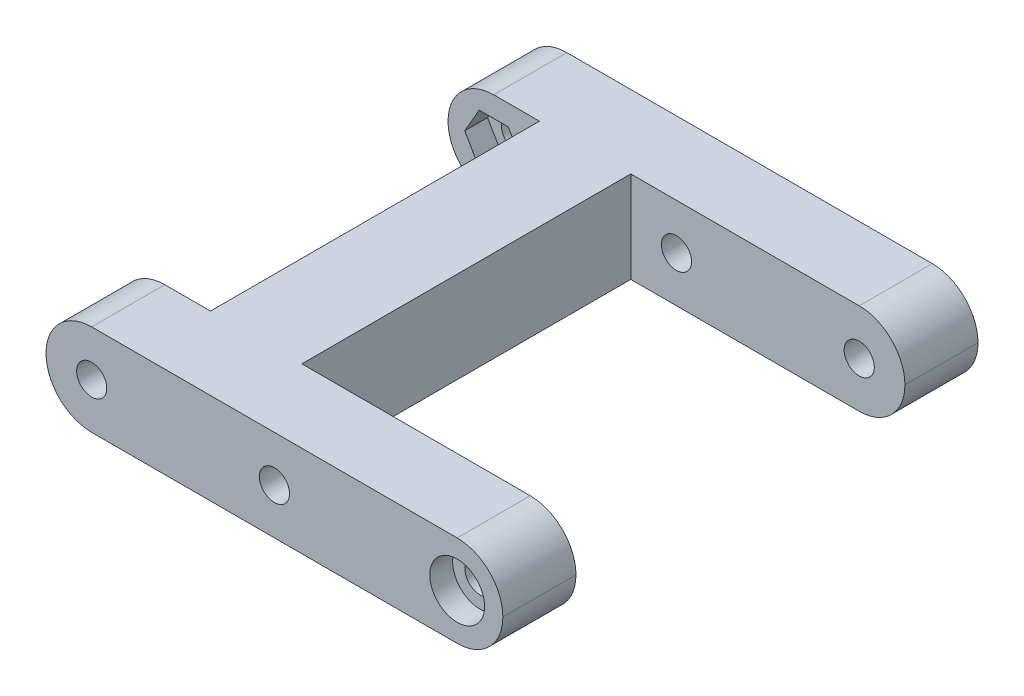
from build123d import *

# Parameters (mm, degrees)
SKICA1_W                 = 50
SKICA1_H                 = 10
P_IDAT_VYSUNUT_M1_DEPTH  = 8
SKICA2_R                 = 1.65
ODEBRAT_VYSUNUT_M1_DEPTH = 52.613951602
ZAOBLIT2_R               = 5
SKICA4_R                 = 1.65
ODEBRAT_VYSUNUT_M2_DEPTH = 10
ODEBRAT_VYSUNUT_M3_DEPTH = 2.5
SKICA6_R                 = 3
ODEBRAT_VYSUNUT_M4_DEPTH = 2.5
SKICA7_W                 = 10
SKICA7_H                 = 10
P_IDAT_VYSUNUT_M2_DEPTH  = 36
SKICA8_W                 = 50
SKICA8_H                 = 10
P_IDAT_VYSUNUT_M3_DEPTH  = 8
ZAOBLIT3_R               = 5
ODEBRAT_START            = -8
SKICA9_R                 = 1.65
ODEBRAT_VYSUNUT_M5_DEPTH = 8
SKICA10_R                = 2.75
ODEBRAT_VYSUNUT_M6_DEPTH = 2.5
ODEBRAT_VYSUNUT_M7_DEPTH = 2.5
ODEBRAT_START_2          = -36
SKICA12_R                = 1.65
ODEBRAT_VYSUNUT_M8_DEPTH = 36


with BuildPart() as part:
    # Skica1 → Přidat vysunutím1 (new body)
    with BuildSketch(Plane.XY):
        with Locations((25, 5)):
            Rectangle(SKICA1_W, SKICA1_H)
    extrude(amount=P_IDAT_VYSUNUT_M1_DEPTH)

    # Skica2 → Odebrat vysunutím1 (cut, through all)
    with BuildSketch(Plane.XY.offset(8)):
        with Locations((5, 5)):
            Circle(SKICA2_R)
        with Locations((45, 5)):
            Circle(SKICA2_R)
    extrude(amount=-ODEBRAT_VYSUNUT_M1_DEPTH, mode=Mode.SUBTRACT)

    # Zaoblit2
    zaoblit2_edges = [part.edges().sort_by_distance(p)[0] for p in [
        (50, 0, 4),
        (50, 10, 4),
        (0, 0, 4),
        (0, 10, 4),
    ]]
    fillet(zaoblit2_edges, radius=ZAOBLIT2_R - 0.0001)  # a hair under: the kernel refuses the full size

    # Skica4 → Odebrat vysunutím2 (cut)
    with BuildSketch(Plane.XY.offset(8)):
        with Locations((25, 5)):
            Circle(SKICA4_R)
    extrude(amount=-ODEBRAT_VYSUNUT_M2_DEPTH, mode=Mode.SUBTRACT)

    # Skica5 → Odebrat vysunutím3 (cut)
    with BuildSketch(Plane(origin=(0, 0, 0), x_dir=(-1, 0, 0), z_dir=(0, 0, -1))):
        Polygon((-1.824573519, 5), (-3.41228676, 7.75), (-6.58771324, 7.75), (-8.175426481, 5), (-6.58771324, 2.25), (-3.41228676, 2.25), align=None)
    extrude(amount=-ODEBRAT_VYSUNUT_M3_DEPTH, mode=Mode.SUBTRACT)

    # Skica6 → Odebrat vysunutím4 (cut)
    with BuildSketch(Plane.XY.offset(8)):
        with Locations((45, 5)):
            Circle(SKICA6_R)
    extrude(amount=-ODEBRAT_VYSUNUT_M4_DEPTH, mode=Mode.SUBTRACT)

    # Skica7 → Přidat vysunutím2 (add)
    with BuildSketch(Plane(origin=(0, 0, 0), x_dir=(-1, 0, 0), z_dir=(0, 0, -1))):
        with Locations((-15, 5)):
            Rectangle(SKICA7_W, SKICA7_H)
    extrude(amount=P_IDAT_VYSUNUT_M2_DEPTH)

    # Skica8 → Přidat vysunutím3 (add)
    with BuildSketch(Plane(origin=(0, 0, -36), x_dir=(-1, 0, 0), z_dir=(0, 0, -1))):
        with Locations((-25, 5)):
            Rectangle(SKICA8_W, SKICA8_H)
    extrude(amount=P_IDAT_VYSUNUT_M3_DEPTH)

    # Zaoblit3
    zaoblit3_edges = [part.edges().sort_by_distance(p)[0] for p in [
        (0, 0, -40),
        (0, 10, -40),
        (50, 0, -40),
        (50, 10, -40),
    ]]
    fillet(zaoblit3_edges, radius=ZAOBLIT3_R - 0.0001)  # a hair under: the kernel refuses the full size

    # Skica9 → Odebrat vysunutím5 (cut)
    with BuildSketch(Plane(origin=(0, 0, -44), x_dir=(-1, 0, 0), z_dir=(0, 0, -1)).offset(ODEBRAT_START)):
        with Locations(Location((-45, 5, 0), (0, 0, 180))):
            Circle(SKICA9_R)
        with Locations(Location((-5, 5, 0), (0, 0, 180))):
            Circle(SKICA9_R)
    extrude(amount=ODEBRAT_VYSUNUT_M5_DEPTH, mode=Mode.SUBTRACT)

    # Skica10 → Odebrat vysunutím6 (cut)
    with BuildSketch(Plane(origin=(0, 0, -44), x_dir=(-1, 0, 0), z_dir=(0, 0, -1))):
        with Locations((-45, 5)):
            Circle(SKICA10_R)
    extrude(amount=-ODEBRAT_VYSUNUT_M6_DEPTH, mode=Mode.SUBTRACT)

    # Skica11 → Odebrat vysunutím7 (cut)
    with BuildSketch(Plane.XY.offset(-36)):
        Polygon((1.824573519, 5), (3.41228676, 2.25), (6.58771324, 2.25), (8.175426481, 5), (6.58771324, 7.75), (3.41228676, 7.75), align=None)
    extrude(amount=-ODEBRAT_VYSUNUT_M7_DEPTH, mode=Mode.SUBTRACT)

    # Skica12 → Odebrat vysunutím8 (cut)
    with BuildSketch(Plane(origin=(0, 0, -44), x_dir=(-1, 0, 0), z_dir=(0, 0, -1)).offset(ODEBRAT_START_2)):
        with Locations(Location((-25, 5, 0), (0, 0, 180))):
            Circle(SKICA12_R)
    extrude(amount=ODEBRAT_VYSUNUT_M8_DEPTH, mode=Mode.SUBTRACT)


solid = part.part
